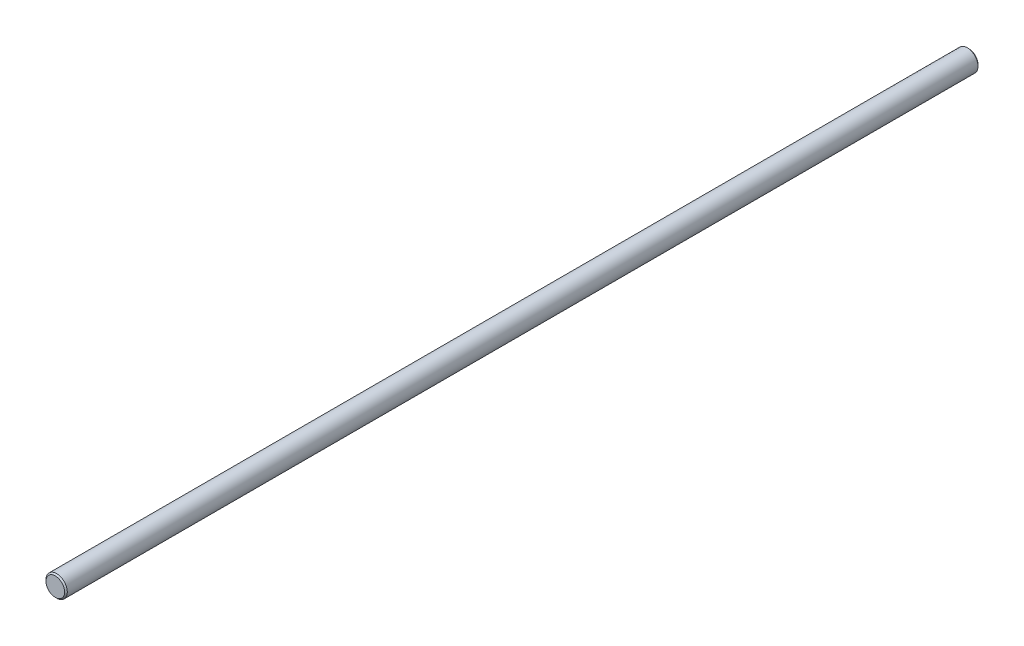
from build123d import *

# Parameters (mm, degrees)
SKETCH1_R           = 4
BOSS_EXTRUDE1_DEPTH = 342.9
CHAMFER1_SIZE       = 0.5


with BuildPart() as part:
    # Sketch1 → Boss-Extrude1 (new body)
    with BuildSketch(Plane.XY):
        Circle(SKETCH1_R)
    extrude(amount=BOSS_EXTRUDE1_DEPTH)

    # Chamfer1
    chamfer1_edges = [part.edges().sort_by_distance(p)[0] for p in [
        (-4, 0, 0),
        (-4, 0, 342.9),
    ]]
    chamfer(chamfer1_edges, length=CHAMFER1_SIZE)


solid = part.part
